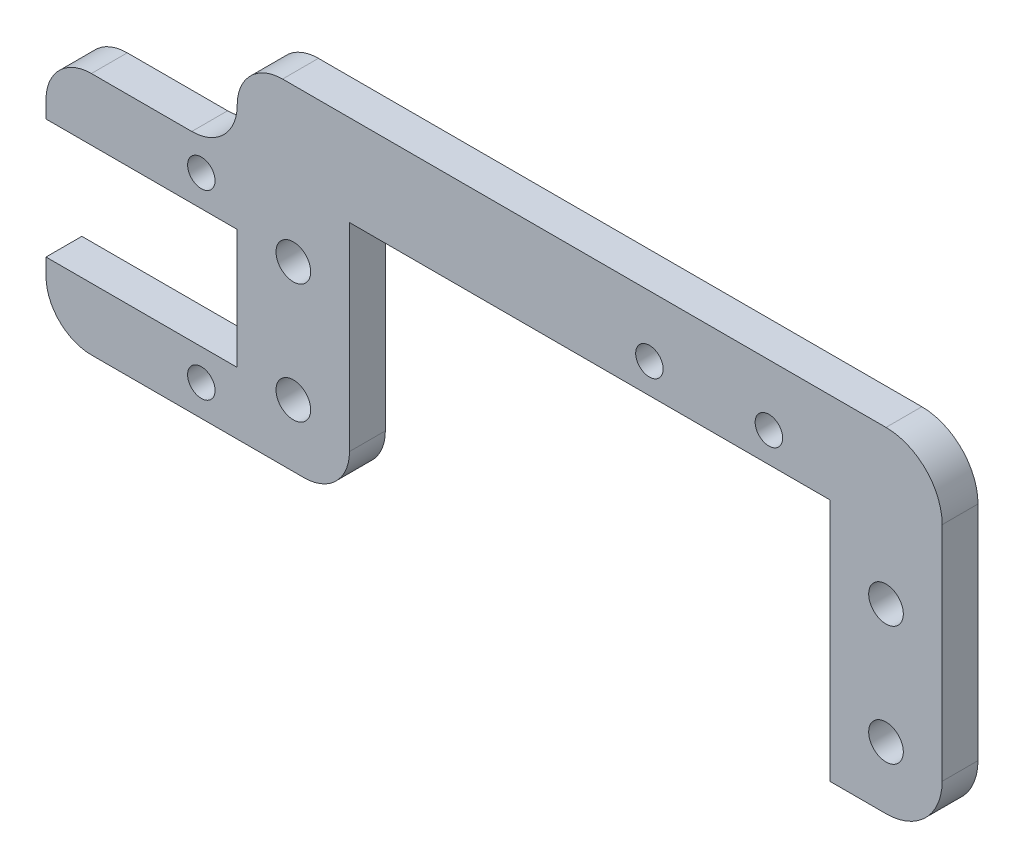
from build123d import *

# Parameters (mm, degrees)
BOSS_EXTRUDE7_DEPTH = 3
SKETCH12_R          = 1.15
CUT_EXTRUDE3_DEPTH  = 70.389048127
SKETCH11_R          = 1.45
CUT_EXTRUDE4_DEPTH  = 70.389048127
SKETCH13_R          = 1.15
CUT_EXTRUDE5_DEPTH  = 70.389048127
FILLET1_R           = 4.7
FILLET2_R           = 3.8


with BuildPart() as part:
    # Sketch10 → Boss-Extrude7 (new body)
    with BuildSketch(Plane.XY):
        Polygon((17.4, 10.2), (57.6, 10.2), (57.6, -10.2), (67, -10.2), (67, 17.8), (8, 17.8), (8, 10.2), (-8, 10.2), (-8, 5), (8, 5), (8, -5), (-8, -5), (-8, -10.2), (17.4, -10.2), align=None)
    extrude(amount=-BOSS_EXTRUDE7_DEPTH)

    # Sketch12 → Cut-Extrude3 (cut, through all)
    with BuildSketch(Plane(origin=(0, 0, 0), x_dir=(-1, 0, 0), z_dir=(0, 0, -1))):
        with Locations((-52.5, 12.7)):
            Circle(SKETCH12_R)
        with Locations((-42.5, 12.7)):
            Circle(SKETCH12_R)
    extrude(amount=CUT_EXTRUDE3_DEPTH, mode=Mode.SUBTRACT)

    # Sketch11 → Cut-Extrude4 (cut, through all)
    with BuildSketch(Plane(origin=(0, 0, 0), x_dir=(-1, 0, 0), z_dir=(0, 0, -1))):
        with Locations((-62.3, -5)):
            Circle(SKETCH11_R)
        with Locations((-12.7, -5)):
            Circle(SKETCH11_R)
        with Locations((-12.7, 5)):
            Circle(SKETCH11_R)
        with Locations((-62.3, 5)):
            Circle(SKETCH11_R)
    extrude(amount=CUT_EXTRUDE4_DEPTH, mode=Mode.SUBTRACT)

    # Sketch13 → Cut-Extrude5 (cut, through all)
    with BuildSketch(Plane.XY):
        with Locations((5, 7.6)):
            Circle(SKETCH13_R)
        with Locations((5, -7.6)):
            Circle(SKETCH13_R)
    extrude(amount=-CUT_EXTRUDE5_DEPTH, mode=Mode.SUBTRACT)

    # Fillet1
    fillet1_edges = [part.edges().sort_by_distance(p)[0] for p in [
        (67, 17.8, -1.5),
        (67, -10.2, -1.5),
    ]]
    fillet(fillet1_edges, radius=FILLET1_R)

    # Fillet2
    fillet2_edges = [part.edges().sort_by_distance(p)[0] for p in [
        (17.4, -10.2, -1.5),
        (-8, -10.2, -1.5),
        (8, 17.8, -1.5),
        (8, 10.2, -1.5),
        (-8, 10.2, -1.5),
    ]]
    fillet(fillet2_edges, radius=FILLET2_R - 0.0001)  # a hair under: the kernel refuses the full size


solid = part.part
